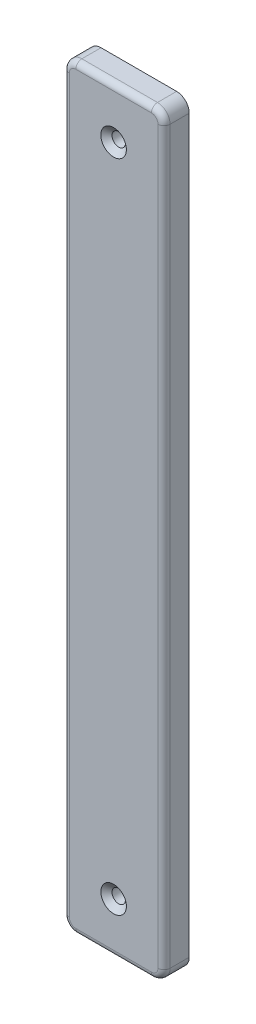
from build123d import *

# Parameters (mm, degrees)
SKETCH1_W                                           = 50.8
SKETCH1_H                                           = 381
BASE_EXTRUDE_DEPTH                                  = 12.7
CSK_FOR_1_4_FLAT_HEAD_MACHINE_SCREW_100_D           = 6.7564
CSK_FOR_1_4_FLAT_HEAD_MACHINE_SCREW_100_CSINK_D     = 12.8778
CSK_FOR_1_4_FLAT_HEAD_MACHINE_SCREW_100_CSINK_ANGLE = 100
FILLET1_R                                           = 6.35
FILLET2_R                                           = 3.048


with BuildPart() as part:
    # Sketch1 → Base-Extrude (new body)
    with BuildSketch(Plane.XY):
        Rectangle(SKETCH1_W, SKETCH1_H)
    extrude(amount=BASE_EXTRUDE_DEPTH)

    # CSK for 1/4 Flat Head Machine Screw (100)1 (through all)
    with Locations(Plane.XY.offset(12.7)):
        with Locations((0, 165.1), (0, -165.1)):
            CounterSinkHole(CSK_FOR_1_4_FLAT_HEAD_MACHINE_SCREW_100_D / 2, CSK_FOR_1_4_FLAT_HEAD_MACHINE_SCREW_100_CSINK_D / 2, counter_sink_angle=CSK_FOR_1_4_FLAT_HEAD_MACHINE_SCREW_100_CSINK_ANGLE)

    # Fillet1
    fillet1_edges = [part.edges().sort_by_distance(p)[0] for p in [
        (25.4, -190.5, 6.35),
        (-25.4, -190.5, 6.35),
        (-25.4, 190.5, 6.35),
        (25.4, 190.5, 6.35),
    ]]
    fillet(fillet1_edges, radius=FILLET1_R)

    # Fillet2
    fillet2_edges = [part.edges().sort_by_distance(p)[0] for p in [
        (-23.540128061, 188.640128061, 12.7),
        (0, 190.5, 12.7),
        (23.540128061, 188.640128061, 12.7),
        (25.4, 0, 12.7),
        (23.540128061, -188.640128061, 12.7),
        (0, -190.5, 12.7),
        (-23.540128061, -188.640128061, 12.7),
        (-25.4, 0, 12.7),
    ]]
    fillet(fillet2_edges, radius=FILLET2_R)


solid = part.part
